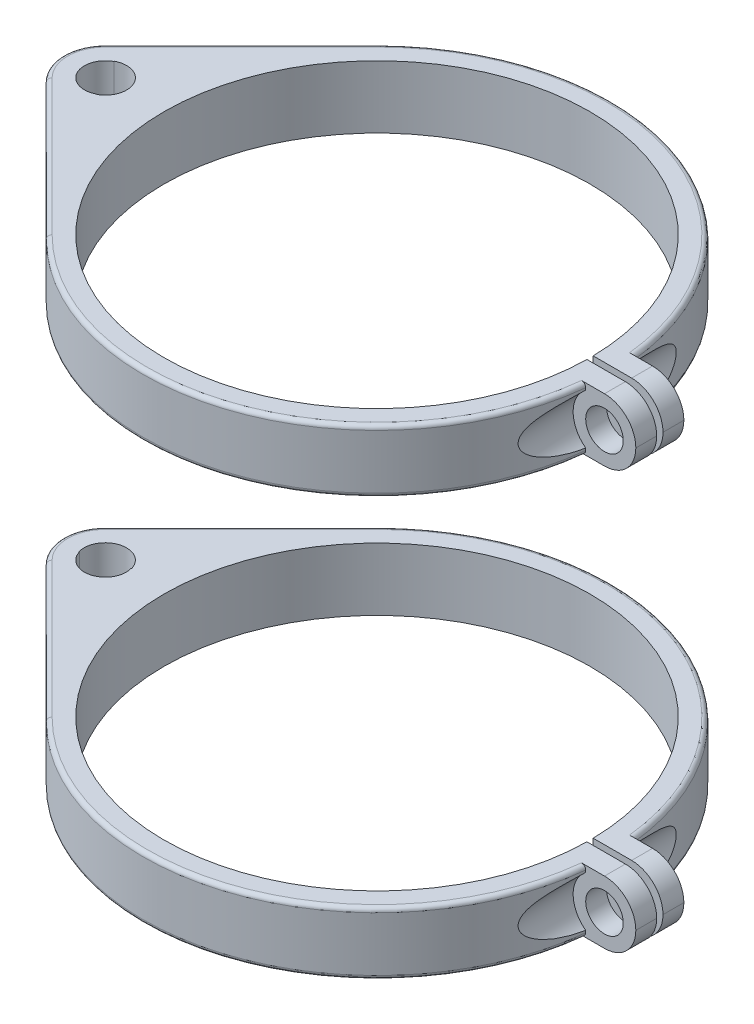
from build123d import *

# Parameters (mm, degrees)
SKETCH1_R               = 5
BOSS_EXTRUDE1_DEPTH     = 15
CUT_EXTRUDE2_DEPTH      = 99.341949225
CUT_EXTRUDE2_DEPTH_BACK = 99.341949225
SKETCH3_R               = 4.5
SKETCH4_R               = 7.5
CUT_EXTRUDE3_DEPTH      = 15.042987435
FILLET1_R               = 7.5
FILLET2_R               = 1
CUT_EXTRUDE4_DEPTH      = 40
CUT_EXTRUDE5_DEPTH      = 40


with BuildPart() as part:
    # Sketch1 → Boss-Extrude1 (new body)
    with BuildSketch(Plane(origin=(0, 0, 0), x_dir=(1, 0, 0), z_dir=(0, 1, 0))):
        with BuildLine():
            Line((-39.597979746, 39.597979746), (-72.124891681, 7.071067812))
            ThreePointArc((-72.124891681, 7.071067812), (-75.053823869, 0), (-72.124891681, -7.071067812))
            Line((-72.124891681, -7.071067812), (-39.597979746, -39.597979746))
            ThreePointArc((-39.597979746, -39.597979746), (18.742266179, -52.770516944), (55.704016911, -5.75))
            Line((55.704016911, -5.75), (67.704016911, -5.75))
            Line((67.704016911, -5.75), (67.704016911, -0.75))
            Line((67.704016911, -0.75), (50.994484996, -0.75))
            ThreePointArc((50.994484996, -0.75), (-51, 0), (50.994484996, 0.75))
            Line((50.994484996, 0.75), (67.704016911, 0.75))
            Line((67.704016911, 0.75), (67.704016911, 5.75))
            Line((67.704016911, 5.75), (55.704016911, 5.75))
            ThreePointArc((55.704016911, 5.75), (18.742266179, 52.770516944), (-39.597979746, 39.597979746))
        make_face()
        with Locations(Location((-65.053823869, 0, 0), (0, 0, 270))):
            Circle(SKETCH1_R, mode=Mode.SUBTRACT)
    extrude(amount=BOSS_EXTRUDE1_DEPTH)

    # Sketch3 → Cut-Extrude2 (cut, two sides: drawn at the far end of the back side and taken through both)
    with BuildSketch(Plane(origin=(0, 0, -5.75), x_dir=(-1, 0, 0), z_dir=(0, 0, -1)).offset(-CUT_EXTRUDE2_DEPTH_BACK)):
        with Locations((-60.204016911, 7.5)):
            Circle(SKETCH3_R)
    extrude(amount=CUT_EXTRUDE2_DEPTH + CUT_EXTRUDE2_DEPTH_BACK, mode=Mode.SUBTRACT)

    # Sketch4 → Cut-Extrude3 (cut)
    with BuildSketch(Plane(origin=(0, 0, -5.75), x_dir=(-1, 0, 0), z_dir=(0, 0, -1))):
        with Locations((-60.204016911, 7.5)):
            Circle(SKETCH4_R)
    cut_extrude3 = extrude(amount=CUT_EXTRUDE3_DEPTH, mode=Mode.SUBTRACT)

    # Mirror8: Cut-Extrude3 across plane
    add(cut_extrude3.mirror(Plane.XY), mode=Mode.SUBTRACT)

    # Fillet1
    fillet1_edges = [part.edges().sort_by_distance(p)[0] for p in [
        (67.704016911, 15, -3.25),
        (67.704016911, 0, -3.25),
        (67.704016911, 0, 3.25),
        (67.704016911, 15, 3.25),
    ]]
    fillet(fillet1_edges, radius=FILLET1_R - 0.0001)  # a hair under: the kernel refuses the full size

    # Fillet2
    fillet2_edges = [part.edges().sort_by_distance(p)[0] for p in [
        (-55.861435714, 0, -23.334523779),
        (18.742266179, 0, -52.770516944),
        (18.742266179, 15, 52.770516944),
        (18.742266179, 0, 52.770516944),
        (-55.861435714, 0, 23.334523779),
        (-75.053823869, 0, 0),
        (18.742266179, 15, -52.770516944),
        (-55.861435714, 15, -23.334523779),
        (-75.053823869, 15, 0),
        (-55.861435714, 15, 23.334523779),
    ]]
    fillet(fillet2_edges, radius=FILLET2_R)


with BuildPart() as body_2:
    # Mirror10: mirrored copy
    add(part.part.mirror(Plane.ZX.offset(57.5)))

    # Sketch10 → Cut-Extrude4 (cut)
    with BuildSketch(Plane(origin=(0, 115, 0), x_dir=(1, 0, 0), z_dir=(0, 1, 0))):
        with BuildLine():
            Line((-67.453823869, 4.5), (-62.653823869, -4.5))
            ThreePointArc((-62.653823869, -4.5), (-60.553823869, 2.4), (-67.453823869, 4.5))
        make_face()
    extrude(amount=-CUT_EXTRUDE4_DEPTH, mode=Mode.SUBTRACT)


with BuildPart() as part_1:
    add(part.part)

    # Sketch11 → Cut-Extrude5 (cut)
    with BuildSketch(Plane(origin=(0, 15, 0), x_dir=(1, 0, 0), z_dir=(0, 1, 0))):
        with BuildLine():
            Line((-60.157823869, 1.428), (-69.949823869, -1.428))
            ThreePointArc((-69.949823869, -1.428), (-66.481823869, 4.896), (-60.157823869, 1.428))
        make_face()
    extrude(amount=-CUT_EXTRUDE5_DEPTH, mode=Mode.SUBTRACT)


solid = Compound([body_2.part, part_1.part])
